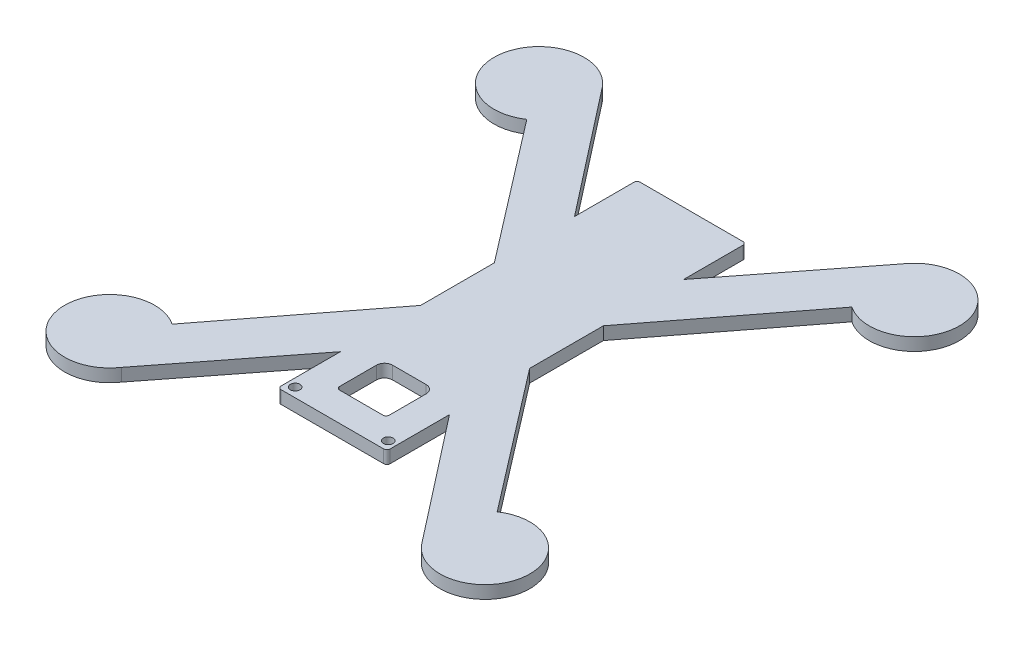
from build123d import *

# Parameters (mm, degrees)
FRAME_SKETCH_R           = 1.5
FRAME_BOTTOM_PLATE_DEPTH = 4


with BuildPart() as part:
    # Frame Sketch → Frame Bottom Plate (new body)
    with BuildSketch(Plane(origin=(0, 0, 0), x_dir=(1, 0, 0), z_dir=(0, 1, 0))):
        with BuildLine():
            Line((-48.674660208, 55.289940373), (-15, 11.5))
            Line((-15, 11.5), (-15, -11.5))
            Line((-15, -11.5), (-48.674660208, -55.289940373))
            ThreePointArc((-48.674660208, -55.289940373), (-70.286313942, -69.618055258), (-44.885336906, -74.828508108))
            Line((-44.885336906, -74.828508108), (-15, -36.5))
            Line((-15, -36.5), (-15, -55))
            ThreePointArc((-15, -55), (-14.707106781, -55.707106781), (-14, -56))
            Line((-14, -56), (18, -56))
            ThreePointArc((18, -56), (18.707106781, -55.707106781), (19, -55))
            Line((19, -55), (19, -36.5))
            Line((19, -36.5), (50.024838487, -76.289940373))
            ThreePointArc((50.024838487, -76.289940373), (74.432680647, -68.702590503), (52.674660208, -55.289940373))
            Line((52.674660208, -55.289940373), (19, -11.5))
            Line((19, -11.5), (19, 11.5))
            Line((19, 11.5), (52.674660208, 55.289940373))
            ThreePointArc((52.674660208, 55.289940373), (74.286313942, 69.618055258), (48.885336906, 74.828508108))
            Line((48.885336906, 74.828508108), (19, 36.5))
            Line((19, 36.5), (19, 55))
            ThreePointArc((19, 55), (18.707106781, 55.707106781), (18, 56))
            Line((18, 56), (-14, 56))
            ThreePointArc((-14, 56), (-14.707106781, 55.707106781), (-15, 55))
            Line((-15, 55), (-15, 36.5))
            Line((-15, 36.5), (-44.885336906, 74.828508108))
            ThreePointArc((-44.885336906, 74.828508108), (-70.286313942, 69.618055258), (-48.674660208, 55.289940373))
        make_face()
        with BuildLine():
            ThreePointArc((-4.75, -47), (-5.457106781, -46.707106781), (-5.75, -46))
            Line((-5.75, -46), (-5.75, -34.5))
            ThreePointArc((-5.75, -34.5), (-5.017766953, -32.732233047), (-3.25, -32))
            Line((-3.25, -32), (7.25, -32))
            ThreePointArc((7.25, -32), (9.017766953, -32.732233047), (9.75, -34.5))
            Line((9.75, -34.5), (9.75, -46))
            ThreePointArc((9.75, -46), (9.457106781, -46.707106781), (8.75, -47))
            Line((8.75, -47), (-4.75, -47))
        make_face(mode=Mode.SUBTRACT)
        with Locations((-12.5, -53.1)):
            Circle(FRAME_SKETCH_R, mode=Mode.SUBTRACT)
        with Locations((16.5, -53.1)):
            Circle(FRAME_SKETCH_R, mode=Mode.SUBTRACT)
    extrude(amount=FRAME_BOTTOM_PLATE_DEPTH)


solid = part.part
